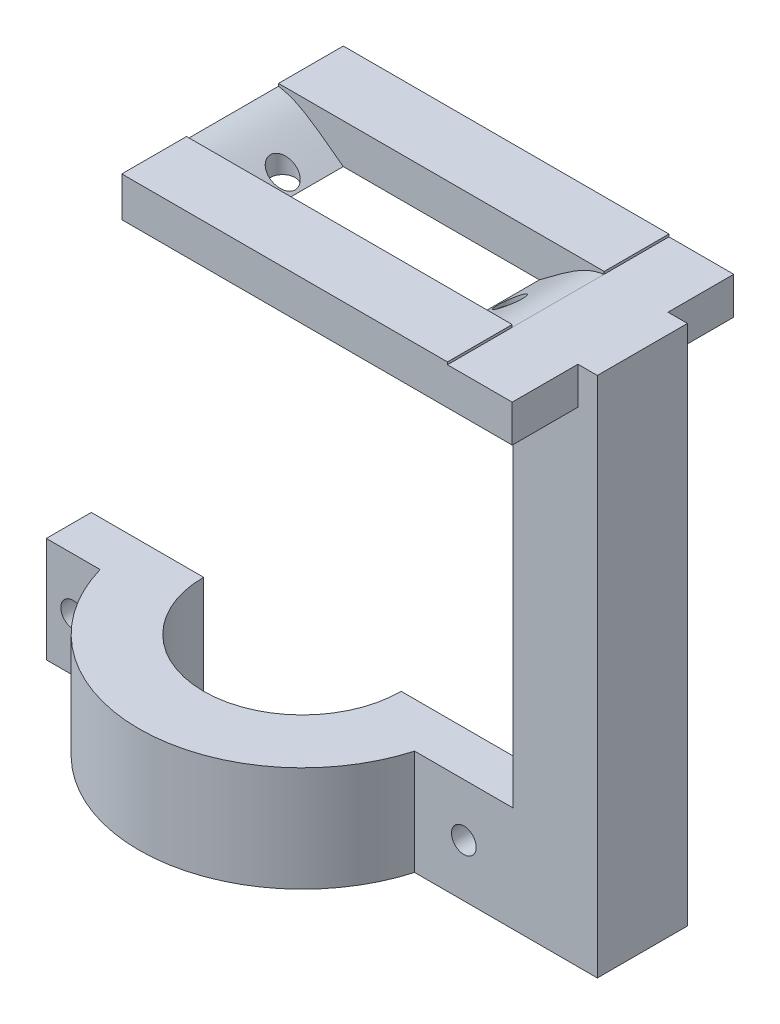
from build123d import *

# Parameters (mm, degrees)
SKETCH_1_W                = 50.28
SKETCH_1_H                = 34.2
SKETCH_1_W_2              = 30.28
SKETCH_1_H_2              = 14.2
EXTRUDE_1_DEPTH           = 12.25
SKETCH_4_W                = 13
SKETCH_4_H                = 13.91
EXTRUDE_1_2_DEPTH         = 74.82
SKETCH_5_W                = 13.91
SKETCH_5_H                = 16.23
EXTRUDE_2_DEPTH           = 16
SKETCH_7_R                = 25.25
SKETCH_7_R_2              = 15.25
EXTRUDE_2_2_DEPTH         = 16.23
SKETCH_15_R               = 1.91
CUT_EXTRUDE_6_DEPTH       = 97.964478439
SKETCH_18_W               = 49.344544624
SKETCH_18_H               = 6.125
CUT_EXTRUDE_8_DEPTH       = 101.789238284
SKETCH_19_W               = 34.2
SKETCH_19_H               = 6.125
CUT_EXTRUDE_9_DEPTH       = 10
SKETCH_21_R               = 1.91
CUT_EXTRUDE_10_DEPTH      = 10
SKETCH_20_R               = 1.91
CUT_EXTRUDE_11_DEPTH      = 10
FILLET_START              = -7.1
FILLET_1_DEPTH            = 14.2
FILLET_2_DEPTH            = 14.2
SKETCH_29_W               = 13.91
SKETCH_29_H               = 74.82
EXTRUDE_5_DEPTH           = 10
SKETCH_30_W               = 10
SKETCH_30_H               = 58.59
CUT_EXTRUDE_13_DEPTH      = 97.964478439
SKETCH_32_W               = 34.2
SKETCH_32_H               = 5.745736365
EXTRUDE_6_DEPTH           = 10
CUT_EXTRUDE_16_DEPTH      = 50
CUT_EXTRUDE_16_DEPTH_BACK = 50
SKETCH_38_W               = 116.985630298
SKETCH_38_H               = 80.538350638
SKETCH_41_W               = 13.91
SKETCH_41_H               = 5.745736365
EXTRUDE_7_DEPTH           = 3
SKETCH_42_W               = 13
SKETCH_42_H               = 13.91
EXTRUDE_8_DEPTH           = 74.82
SKETCH_43_W               = 13.91
SKETCH_43_H               = 16.23
EXTRUDE_9_DEPTH           = 15.22
SKETCH_44_R               = 1.91
CUT_EXTRUDE_17_DEPTH      = 15.22
SKETCH_46_R               = 25.25
SKETCH_46_R_2             = 15.25
EXTRUDE_6_2_DEPTH         = 16.23
EXTRUDE_10_DEPTH          = 7.22
EXTRUDE_10_DEPTH_BACK     = 10
SKETCH_47_W               = 13.91
SKETCH_47_H               = 16.23
SKETCH_50_W               = 3.056753925
SKETCH_50_H               = 16.23
CUT_EXTRUDE_18_DEPTH      = 96.578211037
SKETCH_51_R               = 1.91
CUT_EXTRUDE_19_DEPTH      = 95.015226304
SKETCH_52_W               = 92.841945613
SKETCH_52_H               = 30
CUT_EXTRUDE_20_DEPTH      = 84.840694713


with BuildPart() as part:
    # 草圖1 → Extrude 1 (new body)
    with BuildSketch(Plane(origin=(0, 0, 0), x_dir=(1, 0, 0), z_dir=(0, 1, 0))):
        Rectangle(SKETCH_1_W, SKETCH_1_H)
        Rectangle(SKETCH_1_W_2, SKETCH_1_H_2, mode=Mode.SUBTRACT)
    extrude(amount=EXTRUDE_1_DEPTH)

    # 草圖4 → Extrude 1 2 (add)
    with BuildSketch(Plane.XZ):
        with Locations((18.64, 0)):
            Rectangle(SKETCH_4_W, SKETCH_4_H)
    extrude(amount=EXTRUDE_1_2_DEPTH)

    # 草圖5 → Extrude 2 (add)
    with BuildSketch(Plane.ZY.offset(-12.14)):
        with Locations((0, -66.705)):
            Rectangle(SKETCH_5_W, SKETCH_5_H)
    extrude(amount=EXTRUDE_2_DEPTH)

    # 草圖7 → Extrude 2 2 (add)
    with BuildSketch(Plane(origin=(3.626674765, -74.82, 0), x_dir=(1, 0, 0), z_dir=(0, -1, 0))):
        with Locations((-30.978154344, 0)):
            Circle(SKETCH_7_R)
        with Locations((-30.978154344, 0)):
            Circle(SKETCH_7_R_2, mode=Mode.SUBTRACT)
    extrude(amount=-EXTRUDE_2_2_DEPTH)

    # 草圖15 → 除料-伸長6 (cut, through all)
    with BuildSketch(Plane(origin=(0, 0, -6.955), x_dir=(-1, 0, 0), z_dir=(0, 0, -1))):
        with Locations((-4.530883248, -66.705)):
            Circle(SKETCH_15_R)
    extrude(amount=-CUT_EXTRUDE_6_DEPTH, mode=Mode.SUBTRACT)

    # 草圖18 → 除料-伸長8 (cut, through all)
    with BuildSketch(Plane(origin=(0, 0, -17.1), x_dir=(-1, 0, 0), z_dir=(0, 0, -1))):
        with Locations((0.467727688, 9.1875)):
            Rectangle(SKETCH_18_W, SKETCH_18_H)
    extrude(amount=-CUT_EXTRUDE_8_DEPTH, mode=Mode.SUBTRACT)

    # 草圖19 → 除料-伸長9 (cut)
    with BuildSketch(Plane.ZY.offset(-24.204544624)):
        with Locations((0, 9.1875)):
            Rectangle(SKETCH_19_W, SKETCH_19_H)
    extrude(amount=-CUT_EXTRUDE_9_DEPTH, mode=Mode.SUBTRACT)

    # 草圖21 → 除料-伸長10 (cut)
    with BuildSketch(Plane(origin=(0, 6.125, 0), x_dir=(1, 0, 0), z_dir=(0, 1, 0))):
        with Locations(Location((17.69, 0, 0), (0, 0, 270))):
            Circle(SKETCH_21_R)
    extrude(amount=-CUT_EXTRUDE_10_DEPTH, mode=Mode.SUBTRACT)

    # 草圖20 → 除料-伸長11 (cut)
    with BuildSketch(Plane(origin=(0, 6.125, 0), x_dir=(1, 0, 0), z_dir=(0, 1, 0))):
        with Locations(Location((-17.395, 0, 0), (0, 0, 270))):
            Circle(SKETCH_20_R)
    extrude(amount=-CUT_EXTRUDE_11_DEPTH, mode=Mode.SUBTRACT)

    # 圓角1: read off the stored shape, not the designer's step
    # 圓角1 outline → 圓角1 (cut)
    with BuildSketch(Plane.XY.offset(FILLET_START)):
        with BuildLine():
            add(Edge.make_bspline(
                [(-15.14, 0), (-21.974170252, 5.199829476), (-25.14, 5.745736365)],
                knots=[0, 0, 0, 0.664102345, 0.664102345, 0.664102345], degree=2, weights=[1, 2.223777218, 1.822127795]))
            Line((-15.14, 0), (-15.14, 6.125))
            Line((-15.14, 6.125), (-25.14, 6.125))
            Line((-25.14, 6.125), (-25.14, 5.745736365))
        make_face()
    extrude(amount=FILLET_1_DEPTH, mode=Mode.SUBTRACT)

    # 圓角2: read off the stored shape, not the designer's step
    # 圓角2 outline → 圓角2 (cut)
    with BuildSketch(Plane.XY.offset(FILLET_START)):
        with BuildLine():
            Line((15.14, 6.125), (15.14, 0))
            add(Edge.make_bspline(
                [(15.14, 0), (21.974170252, 5.199829476), (25.14, 5.745736365)],
                knots=[0, 0, 0, 0.664102345, 0.664102345, 0.664102345], degree=2, weights=[1, 2.223777218, 1.822127795]))
            Line((25.14, 5.745736365), (25.14, 6.125))
            Line((25.14, 6.125), (15.14, 6.125))
        make_face()
    extrude(amount=FILLET_2_DEPTH, mode=Mode.SUBTRACT)

    # 草圖29 → 填料-伸長5 (add)
    with BuildSketch(Plane(origin=(25.14, 0, 0), x_dir=(0, 0, -1), z_dir=(1, 0, 0))):
        with Locations((0, -37.41)):
            Rectangle(SKETCH_29_W, SKETCH_29_H)
    extrude(amount=EXTRUDE_5_DEPTH)

    # 草圖30 → 除料-伸長13 (cut, through all)
    with BuildSketch(Plane.XY.offset(6.955)):
        with Locations((17.14, -29.295)):
            Rectangle(SKETCH_30_W, SKETCH_30_H)
    extrude(amount=-CUT_EXTRUDE_13_DEPTH, mode=Mode.SUBTRACT)

    # 草圖32 → Extrude 6 (add)
    with BuildSketch(Plane(origin=(25.14, 0, 0), x_dir=(0, 0, -1), z_dir=(1, 0, 0))):
        with Locations((0, 2.872868182)):
            Rectangle(SKETCH_32_W, SKETCH_32_H)
    extrude(amount=EXTRUDE_6_DEPTH)

    # 草圖38 → 除料-伸長16 (cut, two sides: drawn at the far end of the back side and taken through both)
    with BuildSketch(Plane(origin=(0, 0, -6.955), x_dir=(-1, 0, 0), z_dir=(0, 0, -1)).offset(-CUT_EXTRUDE_16_DEPTH_BACK)):
        with Locations((7.268869252, -40.269175319)):
            Rectangle(SKETCH_38_W, SKETCH_38_H)
    extrude(amount=CUT_EXTRUDE_16_DEPTH + CUT_EXTRUDE_16_DEPTH_BACK, mode=Mode.SUBTRACT)

    # 草圖41 → 填料-伸長7 (add)
    with BuildSketch(Plane(origin=(35.14, 0, 0), x_dir=(0, 0, -1), z_dir=(1, 0, 0))):
        with Locations((0, 2.872868182)):
            Rectangle(SKETCH_41_W, SKETCH_41_H)
    extrude(amount=EXTRUDE_7_DEPTH)

    # 草圖42 → 填料-伸長8 (add)
    with BuildSketch(Plane(origin=(0, 0, 0), x_dir=(-1, 0, 0), z_dir=(0, -1, 0))):
        with Locations((-31.64, 0)):
            Rectangle(SKETCH_42_W, SKETCH_42_H)
    extrude(amount=EXTRUDE_8_DEPTH)

    # 草圖43 → 填料-伸長9 (add)
    with BuildSketch(Plane.ZY.offset(-25.14)):
        with Locations((0, -66.705)):
            Rectangle(SKETCH_43_W, SKETCH_43_H)
    extrude(amount=EXTRUDE_9_DEPTH)

    # 草圖44 → 除料-伸長17 (cut)
    with BuildSketch(Plane(origin=(0, 0, -6.955), x_dir=(-1, 0, 0), z_dir=(0, 0, -1))):
        with Locations(Location((-17.524895264, -66.705, 0), (0, 0, 90))):
            Circle(SKETCH_44_R)
    extrude(amount=-CUT_EXTRUDE_17_DEPTH, mode=Mode.SUBTRACT)

    # 草圖46 → Extrude 6 2 (add)
    with BuildSketch(Plane(origin=(0, -58.59, 0), x_dir=(1, 0, 0), z_dir=(0, 1, 0))):
        with Locations((-14.35, 0)):
            Circle(SKETCH_46_R)
        with Locations((-14.35, 0)):
            Circle(SKETCH_46_R_2, mode=Mode.SUBTRACT)
    extrude(amount=-EXTRUDE_6_2_DEPTH)

    # 草圖47 → 填料-伸長10 (add, two sides: drawn at the far end of the back side and taken through both)
    with BuildSketch(Plane(origin=(-40, 0, 0), x_dir=(0, 0, -1), z_dir=(1, 0, 0)).offset(-EXTRUDE_10_DEPTH_BACK)):
        with Locations((0, -66.705)):
            Rectangle(SKETCH_47_W, SKETCH_47_H)
    extrude(amount=EXTRUDE_10_DEPTH + EXTRUDE_10_DEPTH_BACK)

    # 草圖50 → 除料-伸長18 (cut, through all)
    with BuildSketch(Plane(origin=(0, 0, -6.955), x_dir=(-1, 0, 0), z_dir=(0, 0, -1))):
        with Locations((48.471623038, -66.705)):
            Rectangle(SKETCH_50_W, SKETCH_50_H)
    extrude(amount=-CUT_EXTRUDE_18_DEPTH, mode=Mode.SUBTRACT)

    # 草圖51 → 除料-伸長19 (cut, through all)
    with BuildSketch(Plane(origin=(0, 0, -6.955), x_dir=(-1, 0, 0), z_dir=(0, 0, -1))):
        with Locations((42.786508152, -66.705)):
            Circle(SKETCH_51_R)
    extrude(amount=-CUT_EXTRUDE_19_DEPTH, mode=Mode.SUBTRACT)

    # 草圖52 → 除料-伸長20 (cut, through all)
    with BuildSketch(Plane(origin=(0, -58.59, 0), x_dir=(1, 0, 0), z_dir=(0, 1, 0))):
        with Locations((-21.280972807, 15)):
            Rectangle(SKETCH_52_W, SKETCH_52_H)
    extrude(amount=-CUT_EXTRUDE_20_DEPTH, mode=Mode.SUBTRACT)


solid = part.part
